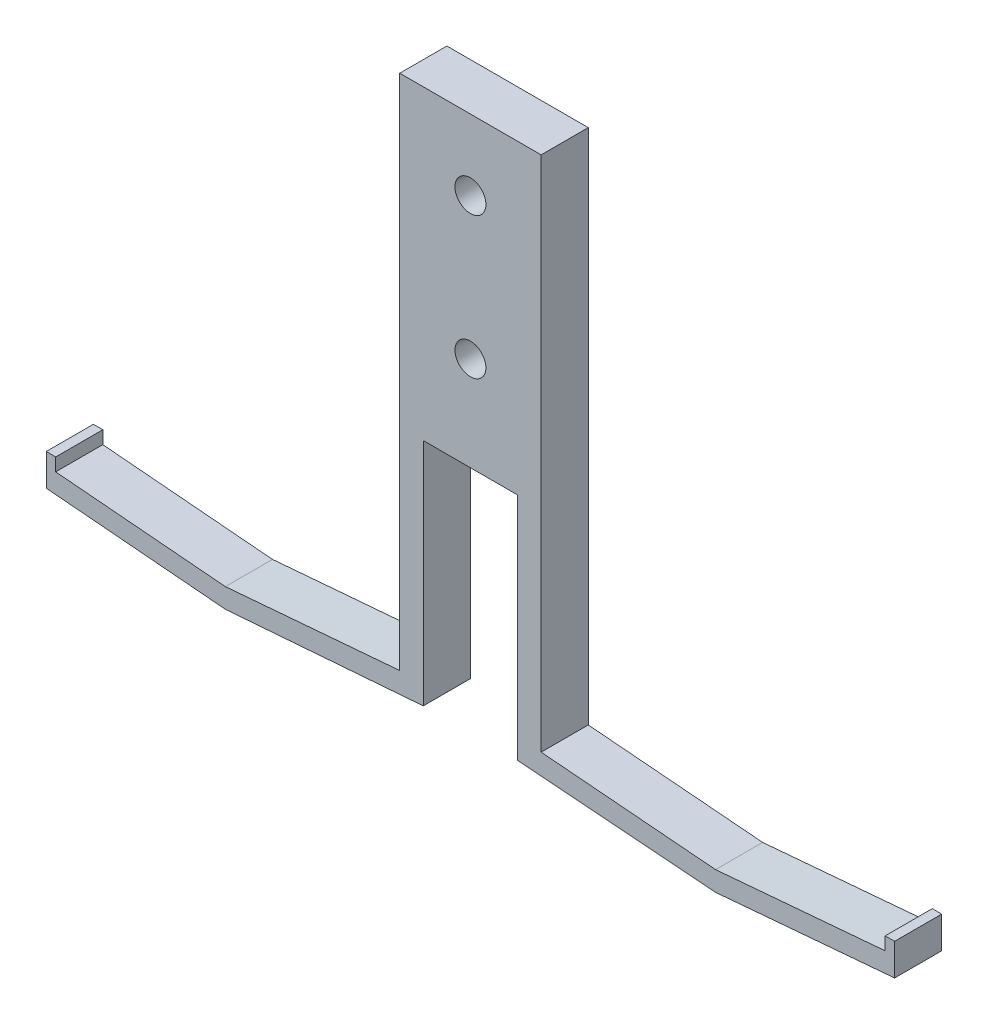
from build123d import *

# Parameters (mm, degrees)
BOSS_EXTRUDE1_DEPTH              = 12.7
F_21_64_0_32813_DIAMETER_HOLE1_D = 8.334502


with BuildPart() as part:
    # Sketch2 → Boss-Extrude1 (new body)
    with BuildSketch(Plane.XY):
        Polygon((12.7, 0), (12.7, -61.9179737), (66.04, -66.051353419), (114.3, -61.9179737), (114.3, -53.351353419), (111.76, -53.351353419), (111.76, -56.8379737), (66.04, -60.753807118), (19.05, -56.8379737), (19.05, 82.55), (-19.05, 82.55), (-19.05, -56.8379737), (-66.04, -60.753807118), (-111.76, -56.8379737), (-111.76, -53.351353419), (-114.3, -53.351353419), (-114.3, -61.9179737), (-66.04, -66.051353419), (-12.7, -61.9179737), (-12.7, 0), align=None)
    extrude(amount=BOSS_EXTRUDE1_DEPTH)

    # 21/64 (0.32813) Diameter Hole1 (through all)
    with Locations(Plane.XY.offset(12.7)):
        with Locations((0, 25.4), (0, 63.5)):
            Hole(F_21_64_0_32813_DIAMETER_HOLE1_D / 2)


solid = part.part
